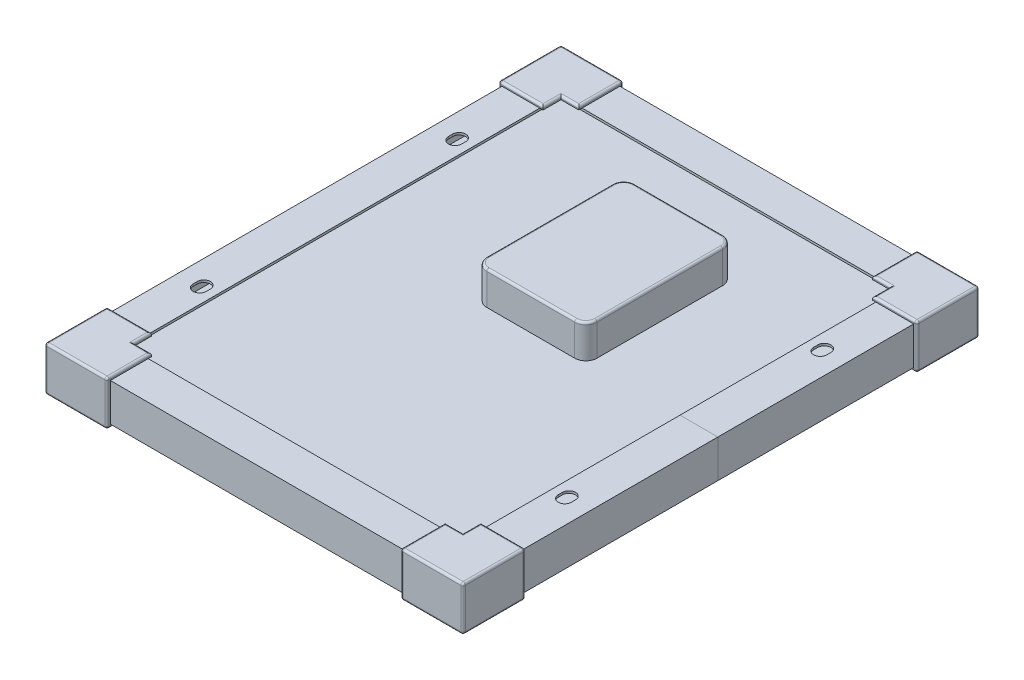
from build123d import *

# Parameters (mm, degrees)
ENL_V_MAT_EXTRU_1_DEPTH         = 10
BOSS_EXTRU_1_DEPTH              = 17
BOSS_EXTRU_1_2_DEPTH            = 17
BOSS_EXTRU_1_3_DEPTH            = 17
BOSS_EXTRU_1_4_DEPTH            = 17
BOSS_EXTRU_2_DEPTH              = 1.5
BOSS_EXTRU_3_DEPTH              = 1.5
CONG_2_R                        = 1
ESQUISSE6_W                     = 183.00001409
ESQUISSE6_H                     = 227.00001409
BOSS_EXTRU_8_DEPTH              = 6
ESQUISSE7_W                     = 17.65
ESQUISSE7_H                     = 17.65
BOSS_EXTRU_9_DEPTH              = 0.1
R_P_TITION_LIN_AIRE1_COUNT      = 8
R_P_TITION_LIN_AIRE1_PITCH      = 19.65
R_P_TITION_LIN_AIRE1_COUNT_DIR2 = 10
R_P_TITION_LIN_AIRE1_PITCH_DIR2 = 19.65
BOSS_EXTRU_10_DEPTH             = 13
BOSS_EXTRU_11_DEPTH             = 2
CONG_3_R                        = 1


with BuildPart() as part:
    # Balayage1: sweep along a path in Esquisse1
    with BuildLine(Plane(origin=(0, 0, 0), x_dir=(1, 0, 0), z_dir=(0, 1, 0))) as balayage1_path:
        Line((-92.5, -114.5), (92.5, -114.5))
        Line((92.5, -114.5), (92.5, 114.5))
        Line((92.5, 114.5), (-92.5, 114.5))
        Line((-92.5, 114.5), (-92.5, -114.5))
    # Esquisse2 → Balayage1 (sweep)
    with BuildSketch(Plane.XY):
        Polygon((86.500007045, 0), (92.500007045, 0), (92.500007045, 17), (75.500007045, 17), (75.500007045, 16), (91.500007045, 16), (91.500007045, 1), (86.500007045, 1), align=None)
    sweep(path=balayage1_path.line, transition=Transition.RIGHT)

    # Esquisse3 → Enlèv. mat.-Extru.1 (cut)
    with BuildSketch(Plane(origin=(0, 17, 0), x_dir=(1, 0, 0), z_dir=(0, 1, 0))):
        with BuildLine():
            Line((-85.000007045, -56.45), (-85.000007045, -57.375))
            Line((-85.000007045, -57.375), (-79.100007045, -57.375))
            Line((-79.100007045, -57.375), (-79.100007045, -56.45))
            ThreePointArc((-79.100007045, -56.45), (-82.050007045, -53.5), (-85.000007045, -56.45))
        make_face()
        with BuildLine():
            Line((-79.100007045, 57.375), (-79.100007045, 58.3))
            ThreePointArc((-79.100007045, 58.3), (-82.050007045, 61.25), (-85.000007045, 58.3))
            Line((-85.000007045, 58.3), (-85.000007045, 57.375))
            Line((-85.000007045, 57.375), (-79.100007045, 57.375))
        make_face()
        with BuildLine():
            Line((-79.100007045, 56.45), (-79.100007045, 57.375))
            Line((-79.100007045, 57.375), (-85.000007045, 57.375))
            Line((-85.000007045, 57.375), (-85.000007045, 56.45))
            ThreePointArc((-85.000007045, 56.45), (-82.050007045, 53.5), (-79.100007045, 56.45))
        make_face()
        with BuildLine():
            Line((79.100007045, 57.375), (85.000007045, 57.375))
            Line((85.000007045, 57.375), (85.000007045, 58.3))
            ThreePointArc((85.000007045, 58.3), (82.050007045, 61.25), (79.100007045, 58.3))
            Line((79.100007045, 58.3), (79.100007045, 57.375))
        make_face()
        with BuildLine():
            Line((85.000007045, 56.45), (85.000007045, 57.375))
            Line((85.000007045, 57.375), (79.100007045, 57.375))
            Line((79.100007045, 57.375), (79.100007045, 56.45))
            ThreePointArc((79.100007045, 56.45), (82.050007045, 53.5), (85.000007045, 56.45))
        make_face()
        with BuildLine():
            Line((79.100007045, -57.375), (85.000007045, -57.375))
            Line((85.000007045, -57.375), (85.000007045, -56.45))
            ThreePointArc((85.000007045, -56.45), (82.050007045, -53.5), (79.100007045, -56.45))
            Line((79.100007045, -56.45), (79.100007045, -57.375))
        make_face()
        with BuildLine():
            Line((85.000007045, -58.3), (85.000007045, -57.375))
            Line((85.000007045, -57.375), (79.100007045, -57.375))
            Line((79.100007045, -57.375), (79.100007045, -58.3))
            ThreePointArc((79.100007045, -58.3), (82.050007045, -61.25), (85.000007045, -58.3))
        make_face()
        with BuildLine():
            Line((-79.100007045, -57.375), (-85.000007045, -57.375))
            Line((-85.000007045, -57.375), (-85.000007045, -58.3))
            ThreePointArc((-85.000007045, -58.3), (-82.050007045, -61.25), (-79.100007045, -58.3))
            Line((-79.100007045, -58.3), (-79.100007045, -57.375))
        make_face()
    extrude(amount=-ENL_V_MAT_EXTRU_1_DEPTH, mode=Mode.SUBTRACT)



with BuildPart() as body_2:
    # Esquisse4 → Boss.-Extru.1 (new body)
    with BuildSketch(Plane(origin=(0, 17, 0), x_dir=(1, 0, 0), z_dir=(0, 1, 0))):
        Polygon((-66.000007045, 114.500007045), (-66.000007045, 116.000007045), (-94.000007045, 116.000007045), (-94.000007045, 88.000007045), (-92.500007045, 88.000007045), (-92.500007045, 114.500007045), align=None)
    extrude(amount=-BOSS_EXTRU_1_DEPTH)


with BuildPart() as body_3:
    # Esquisse4 → Boss.-Extru.1 2 (new body)
    with BuildSketch(Plane(origin=(0, 17, 0), x_dir=(1, 0, 0), z_dir=(0, 1, 0))):
        Polygon((92.500007045, 114.500007045), (92.500007045, 88.000007045), (94.000007045, 88.000007045), (94.000007045, 116.000007045), (66.000007045, 116.000007045), (66.000007045, 114.500007045), align=None)
    extrude(amount=-BOSS_EXTRU_1_2_DEPTH)


with BuildPart() as body_4:
    # Esquisse4 → Boss.-Extru.1 3 (new body)
    with BuildSketch(Plane(origin=(0, 17, 0), x_dir=(1, 0, 0), z_dir=(0, 1, 0))):
        Polygon((66.000007045, -114.500007045), (66.000007045, -116.000007045), (94.000007045, -116.000007045), (94.000007045, -88.000007045), (92.500007045, -88.000007045), (92.500007045, -114.500007045), align=None)
    extrude(amount=-BOSS_EXTRU_1_3_DEPTH)


with BuildPart() as body_5:
    # Esquisse4 → Boss.-Extru.1 4 (new body)
    with BuildSketch(Plane(origin=(0, 17, 0), x_dir=(1, 0, 0), z_dir=(0, 1, 0))):
        Polygon((-92.500007045, -114.500007045), (-92.500007045, -88.000007045), (-94.000007045, -88.000007045), (-94.000007045, -116.000007045), (-66.000007045, -116.000007045), (-66.000007045, -114.500007045), align=None)
    extrude(amount=-BOSS_EXTRU_1_4_DEPTH)


with BuildPart() as part_1:
    add(part.part)

    add(body_2.part)  # Boss.-Extru.2 merges body 2

    add(body_3.part)  # Boss.-Extru.2 merges body 3

    add(body_4.part)  # Boss.-Extru.2 merges body 4

    add(body_5.part)  # Boss.-Extru.2 merges body 5
    # Esquisse4<3> → Boss.-Extru.2 (add)
    with BuildSketch(Plane(origin=(0, 17, 0), x_dir=(1, 0, 0), z_dir=(0, 1, 0))):
        Polygon((-66.000007045, 116.000007045), (-94.000007045, 116.000007045), (-94.000007045, 88.000007045), (-74.000007045, 88.000007045), (-74.000007045, 96.000007045), (-66.000007045, 96.000007045), align=None)
        Polygon((66.000007045, 96.000007045), (66.000007045, 116.000007045), (94.000007045, 116.000007045), (94.000007045, 88.000007045), (74.000007045, 88.000007045), (74.000007045, 96.000007045), align=None)
        Polygon((66.000007045, -116.000007045), (94.000007045, -116.000007045), (94.000007045, -88.000007045), (74.000007045, -88.000007045), (74.000007045, -96.000007045), (66.000007045, -96.000007045), align=None)
        Polygon((-66.000007045, -96.000007045), (-66.000007045, -116.000007045), (-94.000007045, -116.000007045), (-94.000007045, -88.000007045), (-74.000007045, -88.000007045), (-74.000007045, -96.000007045), align=None)
    extrude(amount=BOSS_EXTRU_2_DEPTH)

    # Esquisse5 → Boss.-Extru.3 (add)
    with BuildSketch(Plane.XZ):
        Polygon((-66.000007045, -116.000007045), (-94.000007045, -116.000007045), (-94.000007045, -88.000007045), (-85.000007045, -88.000007045), (-85.000007045, -107.000007045), (-66.000007045, -107.000007045), align=None)
        Polygon((85.000007045, -88.000007045), (94.000007045, -88.000007045), (94.000007045, -116.000007045), (66.000007045, -116.000007045), (66.000007045, -107.000007045), (85.000007045, -107.000007045), align=None)
        Polygon((66.000007045, 116.000007045), (94.000007045, 116.000007045), (94.000007045, 88.000007045), (85.000007045, 88.000007045), (85.000007045, 107.000007045), (66.000007045, 107.000007045), align=None)
        Polygon((-85.000007045, 88.000007045), (-94.000007045, 88.000007045), (-94.000007045, 116.000007045), (-66.000007045, 116.000007045), (-66.000007045, 107.000007045), (-85.000007045, 107.000007045), align=None)
    extrude(amount=BOSS_EXTRU_3_DEPTH)

    # Congé2
    cong_2_edges = [part_1.edges().sort_by_distance(p)[0] for p in [
        (-80.000007045, 18.5, 116.000007045),
        (-94.000007045, 8.5, 116.000007045),
        (-66.000007045, 18.5, 106.000007045),
        (-66.000007045, 8.5, 116.000007045),
        (-70.000007045, 18.5, 96.000007045),
        (-74.000007045, 18.5, 92.000007045),
        (-84.000007045, 18.5, 88.000007045),
        (-94.000007045, 18.5, 102.000007045),
        (-94.000007045, 8.5, 88.000007045),
        (-66.000007045, 8.5, -116.000007045),
        (-94.000007045, 8.5, -116.000007045),
        (-94.000007045, 8.5, -88.000007045),
        (66.000007045, 8.5, 116.000007045),
        (94.000007045, 8.5, 116.000007045),
        (94.000007045, 8.5, 88.000007045),
        (66.000007045, 8.5, -116.000007045),
        (94.000007045, 8.5, -116.000007045),
        (94.000007045, 8.5, -88.000007045),
        (80.000007045, 18.5, 116.000007045),
        (94.000007045, 18.5, 102.000007045),
        (84.000007045, 18.5, 88.000007045),
        (74.000007045, 18.5, 92.000007045),
        (70.000007045, 18.5, 96.000007045),
        (66.000007045, 18.5, 106.000007045),
        (80.000007045, 18.5, -116.000007045),
        (66.000007045, 18.5, -106.000007045),
        (70.000007045, 18.5, -96.000007045),
        (74.000007045, 18.5, -92.000007045),
        (84.000007045, 18.5, -88.000007045),
        (94.000007045, 18.5, -102.000007045),
        (-80.000007045, 18.5, -116.000007045),
        (-94.000007045, 18.5, -102.000007045),
        (-84.000007045, 18.5, -88.000007045),
        (-74.000007045, 18.5, -92.000007045),
        (-70.000007045, 18.5, -96.000007045),
        (-66.000007045, 18.5, -106.000007045),
        (-66.000007045, -1.5, -111.500007045),
        (-75.500007045, -1.5, -107.000007045),
        (-85.000007045, -1.5, -97.500007045),
        (-89.500007045, -1.5, -88.000007045),
        (-94.000007045, -1.5, -102.000007045),
        (-80.000007045, -1.5, -116.000007045),
        (85.000007045, -1.5, -97.500007045),
        (75.500007045, -1.5, -107.000007045),
        (66.000007045, -1.5, -111.500007045),
        (80.000007045, -1.5, -116.000007045),
        (94.000007045, -1.5, -102.000007045),
        (89.500007045, -1.5, -88.000007045),
        (66.000007045, -1.5, 111.500007045),
        (75.500007045, -1.5, 107.000007045),
        (85.000007045, -1.5, 97.500007045),
        (89.500007045, -1.5, 88.000007045),
        (94.000007045, -1.5, 102.000007045),
        (80.000007045, -1.5, 116.000007045),
        (-85.000007045, -1.5, 97.500007045),
        (-75.500007045, -1.5, 107.000007045),
        (-66.000007045, -1.5, 111.500007045),
        (-80.000007045, -1.5, 116.000007045),
        (-94.000007045, -1.5, 102.000007045),
        (-89.500007045, -1.5, 88.000007045),
        (0, 0, -108.500007045),
        (86.500007045, 0, 0),
        (0, 0, 108.500007045),
        (-86.500007045, 0, 0),
    ]]
    fillet(cong_2_edges, radius=CONG_2_R - 0.0001)  # a hair under: the kernel refuses the full size

    # Esquisse6 → Boss.-Extru.8 (add)
    with BuildSketch(Plane(origin=(0, 1, 0), x_dir=(1, 0, 0), z_dir=(0, 1, 0))):
        Rectangle(ESQUISSE6_W, ESQUISSE6_H)
    extrude(amount=BOSS_EXTRU_8_DEPTH)

    # Esquisse7 → Boss.-Extru.9 (add)
    with BuildSketch(Plane.XZ.offset(-1)):
        with Locations((68.775007045, -88.175007045)):
            Rectangle(ESQUISSE7_W, ESQUISSE7_H)
    boss_extru_9 = extrude(amount=BOSS_EXTRU_9_DEPTH)

    # Répétition linéaire1: Boss.-Extru.9 8 × 10
    with Locations(*[(-i * R_P_TITION_LIN_AIRE1_PITCH, 0, j * R_P_TITION_LIN_AIRE1_PITCH_DIR2) for i in range(R_P_TITION_LIN_AIRE1_COUNT) for j in range(R_P_TITION_LIN_AIRE1_COUNT_DIR2) if (i, j) != (0, 0)]):
        add(boss_extru_9)

    # Esquisse8 → Boss.-Extru.10 (add)
    with BuildSketch(Plane(origin=(0, 7, 0), x_dir=(1, 0, 0), z_dir=(0, 1, 0))):
        with BuildLine():
            Line((-19.82453465, 75.000007045), (19.67546535, 75.000007045))
            ThreePointArc((19.67546535, 75.000007045), (23.210999256, 73.535540951), (24.67546535, 70.000007045))
            Line((24.67546535, 70.000007045), (24.67546535, 13.500007045))
            ThreePointArc((24.67546535, 13.500007045), (23.210999256, 9.964473139), (19.67546535, 8.500007045))
            Line((19.67546535, 8.500007045), (-19.82453465, 8.500007045))
            ThreePointArc((-19.82453465, 8.500007045), (-23.360068556, 9.964473139), (-24.82453465, 13.500007045))
            Line((-24.82453465, 13.500007045), (-24.82453465, 70.000007045))
            ThreePointArc((-24.82453465, 70.000007045), (-23.360068556, 73.535540951), (-19.82453465, 75.000007045))
        make_face()
        with BuildLine():
            Line((-17.82453465, 73.000007045), (17.67546535, 73.000007045))
            ThreePointArc((17.67546535, 73.000007045), (21.210999256, 71.535540951), (22.67546535, 68.000007045))
            Line((22.67546535, 68.000007045), (22.67546535, 15.500007045))
            ThreePointArc((22.67546535, 15.500007045), (21.210999256, 11.964473139), (17.67546535, 10.500007045))
            Line((17.67546535, 10.500007045), (-17.82453465, 10.500007045))
            ThreePointArc((-17.82453465, 10.500007045), (-21.360068556, 11.964473139), (-22.82453465, 15.500007045))
            Line((-22.82453465, 15.500007045), (-22.82453465, 68.000007045))
            ThreePointArc((-22.82453465, 68.000007045), (-21.360068556, 71.535540951), (-17.82453465, 73.000007045))
        make_face(mode=Mode.SUBTRACT)
    extrude(amount=BOSS_EXTRU_10_DEPTH)

    # Esquisse9 → Boss.-Extru.11 (add)
    with BuildSketch(Plane(origin=(0, 20, 0), x_dir=(1, 0, 0), z_dir=(0, 1, 0))):
        with BuildLine():
            Line((19.67546535, 75.000007045), (-19.82453465, 75.000007045))
            ThreePointArc((-19.82453465, 75.000007045), (-23.360068556, 73.535540951), (-24.82453465, 70.000007045))
            Line((-24.82453465, 70.000007045), (-24.82453465, 13.500007045))
            ThreePointArc((-24.82453465, 13.500007045), (-23.360068556, 9.964473139), (-19.82453465, 8.500007045))
            Line((-19.82453465, 8.500007045), (19.67546535, 8.500007045))
            ThreePointArc((19.67546535, 8.500007045), (23.210999256, 9.964473139), (24.67546535, 13.500007045))
            Line((24.67546535, 13.500007045), (24.67546535, 70.000007045))
            ThreePointArc((24.67546535, 70.000007045), (23.210999256, 73.535540951), (19.67546535, 75.000007045))
        make_face()
    extrude(amount=BOSS_EXTRU_11_DEPTH)

    # Congé3
    cong_3_edges = [part_1.edges().sort_by_distance(p)[0] for p in [
        (23.210999256, 22, -73.535540951),
        (-0.07453465, 22, -75.000007045),
        (-23.360068556, 22, -73.535540951),
        (-24.82453465, 22, -41.750007045),
        (-23.360068556, 22, -9.964473139),
        (-0.07453465, 22, -8.500007045),
        (23.210999256, 22, -9.964473139),
        (24.67546535, 22, -41.750007045),
    ]]
    fillet(cong_3_edges, radius=CONG_3_R)


solid = part_1.part
